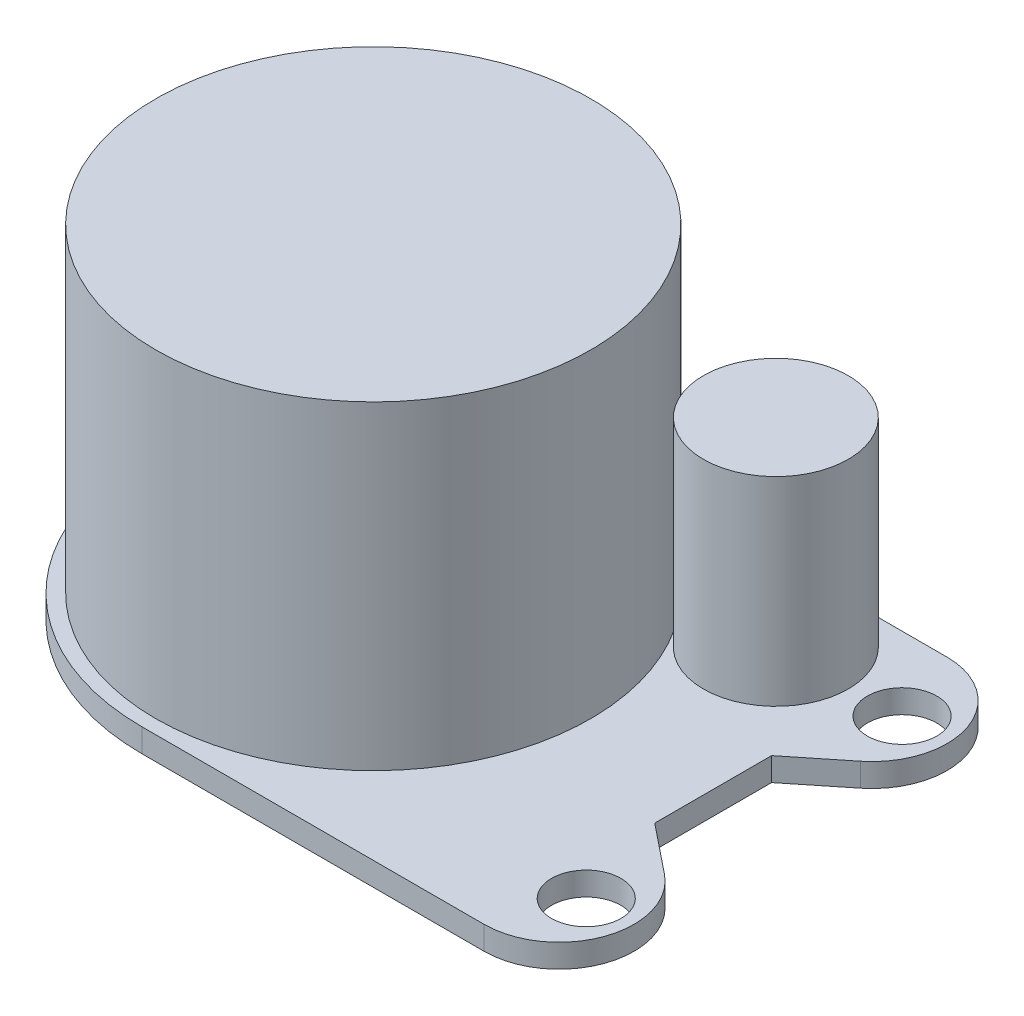
from build123d import *

# Parameters (mm, degrees)
BOSS_EXTRUDE1_DEPTH = 1
SKETCH2_R           = 9.305
BOSS_EXTRUDE2_DEPTH = 13.66
SKETCH3_R           = 3.1
BOSS_EXTRUDE3_DEPTH = 8.51
SKETCH4_R           = 1.485
CUT_EXTRUDE1_DEPTH  = 8.51


with BuildPart() as part:
    # Sketch1 → Boss-Extrude1 (new body)
    with BuildSketch(Plane(origin=(0, 0, 0), x_dir=(1, 0, 0), z_dir=(0, 1, 0))):
        with BuildLine():
            Line((-13.933041308, 13.509742501), (-28.57709975, 13.509742501))
            ThreePointArc((-28.57709975, 13.509742501), (-38.47709975, 3.609742501), (-28.57709975, -6.290257499))
            Line((-28.57709975, -6.290257499), (-13.933041308, -6.290257499))
            ThreePointArc((-13.933041308, -6.290257499), (-10.908622294, -4.147777693), (-11.926545628, -0.583908702))
            Line((-11.926545628, -0.583908702), (-14.03709975, 1.109742501))
            Line((-14.03709975, 1.109742501), (-14.03709975, 6.109742501))
            Line((-14.03709975, 6.109742501), (-11.926545628, 7.803393704))
            ThreePointArc((-11.926545628, 7.803393704), (-10.908622294, 11.367262695), (-13.933041308, 13.509742501))
        make_face()
    extrude(amount=BOSS_EXTRUDE1_DEPTH)

    # Sketch2 → Boss-Extrude2 (add)
    with BuildSketch(Plane(origin=(0, 1, 0), x_dir=(1, 0, 0), z_dir=(0, 1, 0))):
        with Locations((-28.57709975, 3.609742501)):
            Circle(SKETCH2_R)
    extrude(amount=BOSS_EXTRUDE2_DEPTH)

    # Sketch3 → Boss-Extrude3 (add)
    with BuildSketch(Plane(origin=(0, 1, 0), x_dir=(1, 0, 0), z_dir=(0, 1, 0))):
        with Locations((-17.962659231, 10.215706191)):
            Circle(SKETCH3_R)
    extrude(amount=BOSS_EXTRUDE3_DEPTH)

    # Sketch4 → Cut-Extrude1 (cut)
    with BuildSketch(Plane(origin=(0, 1, 0), x_dir=(1, 0, 0), z_dir=(0, 1, 0))):
        with Locations((-12.71209975, 10.364742501)):
            Circle(SKETCH4_R)
        with Locations((-12.71209975, -3.145257499)):
            Circle(SKETCH4_R)
    extrude(amount=-CUT_EXTRUDE1_DEPTH, mode=Mode.SUBTRACT)


solid = part.part
